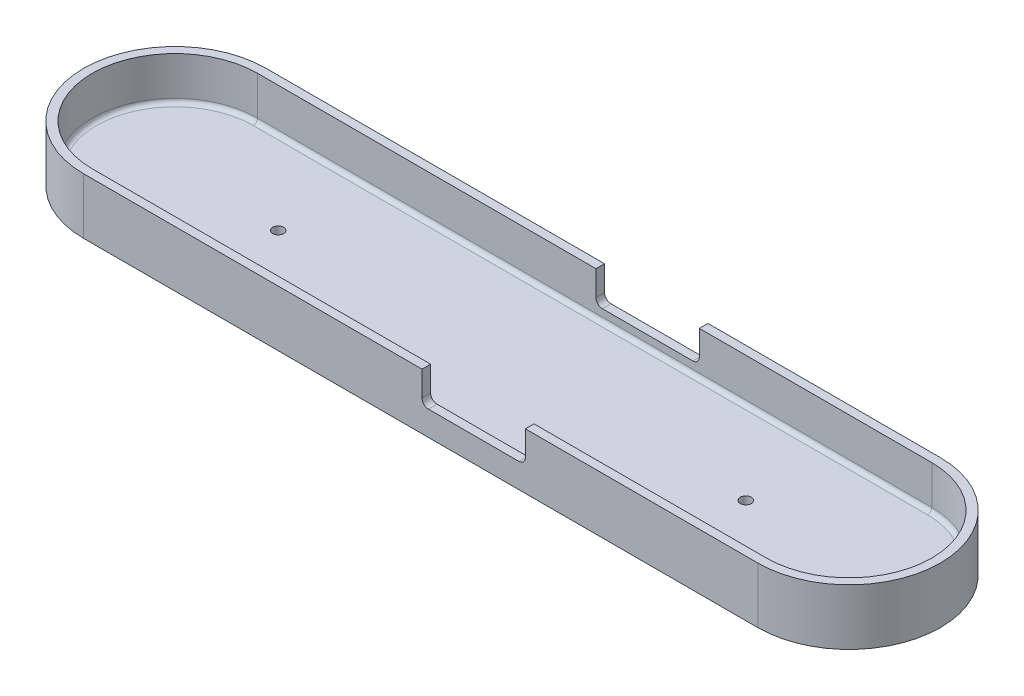
from build123d import *

# Parameters (mm, degrees)
MAINBLOCK_DEPTH               = 3.81
BOSS_EXTRUDE1_DEPTH           = 16.51
SKETCH3_R                     = 1.6256
CUT_EXTRUDE1_DEPTH            = 131.252044518
FILLET1_R                     = 1.27
SKETCH4_W                     = 30.48
SKETCH4_H                     = 2.54
STABILIZER_MOUNT_CUTOUT_DEPTH = 9.271
FILLET2_R                     = 1.905


with BuildPart() as part:
    # Sketch1 → MainBlock (new body)
    with BuildSketch(Plane(origin=(0, 0, 0), x_dir=(1, 0, 0), z_dir=(0, 1, 0))):
        with BuildLine():
            Line((-99.441, 24.384), (99.441, 24.384))
            ThreePointArc((99.441, 24.384), (123.825, 0), (99.441, -24.384))
            Line((99.441, -24.384), (-99.441, -24.384))
            ThreePointArc((-99.441, -24.384), (-123.825, 0), (-99.441, 24.384))
        make_face()
    extrude(amount=MAINBLOCK_DEPTH)

    # Sketch2 → Boss-Extrude1 (add)
    with BuildSketch(Plane.XZ):
        with BuildLine():
            Line((-99.441, 26.924), (99.441, 26.924))
            ThreePointArc((99.441, 26.924), (126.365, 0), (99.441, -26.924))
            Line((99.441, -26.924), (-99.441, -26.924))
            ThreePointArc((-99.441, -26.924), (-126.365, 0), (-99.441, 26.924))
        make_face()
        with BuildLine():
            Line((99.441, 24.384), (-99.441, 24.384))
            ThreePointArc((-99.441, 24.384), (-123.825, 0), (-99.441, -24.384))
            Line((-99.441, -24.384), (99.441, -24.384))
            ThreePointArc((99.441, -24.384), (123.825, 0), (99.441, 24.384))
        make_face(mode=Mode.SUBTRACT)
    extrude(amount=-BOSS_EXTRUDE1_DEPTH)

    # Sketch3 → Cut-Extrude1 (cut, through all)
    with BuildSketch(Plane.XZ):
        with Locations((-68.961, 0)):
            Circle(SKETCH3_R)
        with Locations((68.961, 0)):
            Circle(SKETCH3_R)
    extrude(amount=-CUT_EXTRUDE1_DEPTH, mode=Mode.SUBTRACT)

    # Fillet1
    fillet1_edges = [part.edges().sort_by_distance(p)[0] for p in [
        (123.825, 3.81, 0),
        (0, 3.81, 24.384),
        (-123.825, 3.81, 0),
        (0, 3.81, -24.384),
    ]]
    fillet(fillet1_edges, radius=FILLET1_R)

    # Sketch4 → Stabilizer-Mount-Cutout (cut)
    with BuildSketch(Plane(origin=(0, 16.51, 0), x_dir=(1, 0, 0), z_dir=(0, 1, 0))):
        with Locations((15.621, 25.654)):
            Rectangle(SKETCH4_W, SKETCH4_H)
    stabilizer_mount_cutout = extrude(amount=-STABILIZER_MOUNT_CUTOUT_DEPTH, mode=Mode.SUBTRACT)

    # Mirror1: Stabilizer-Mount-Cutout across plane
    add(stabilizer_mount_cutout.mirror(Plane.XY), mode=Mode.SUBTRACT)

    # Fillet2
    fillet2_edges = [part.edges().sort_by_distance(p)[0] for p in [
        (0.381, 7.239, -25.654),
        (30.861, 7.239, -25.654),
        (0.381, 7.239, 25.654),
        (30.861, 7.239, 25.654),
    ]]
    fillet(fillet2_edges, radius=FILLET2_R)


solid = part.part
